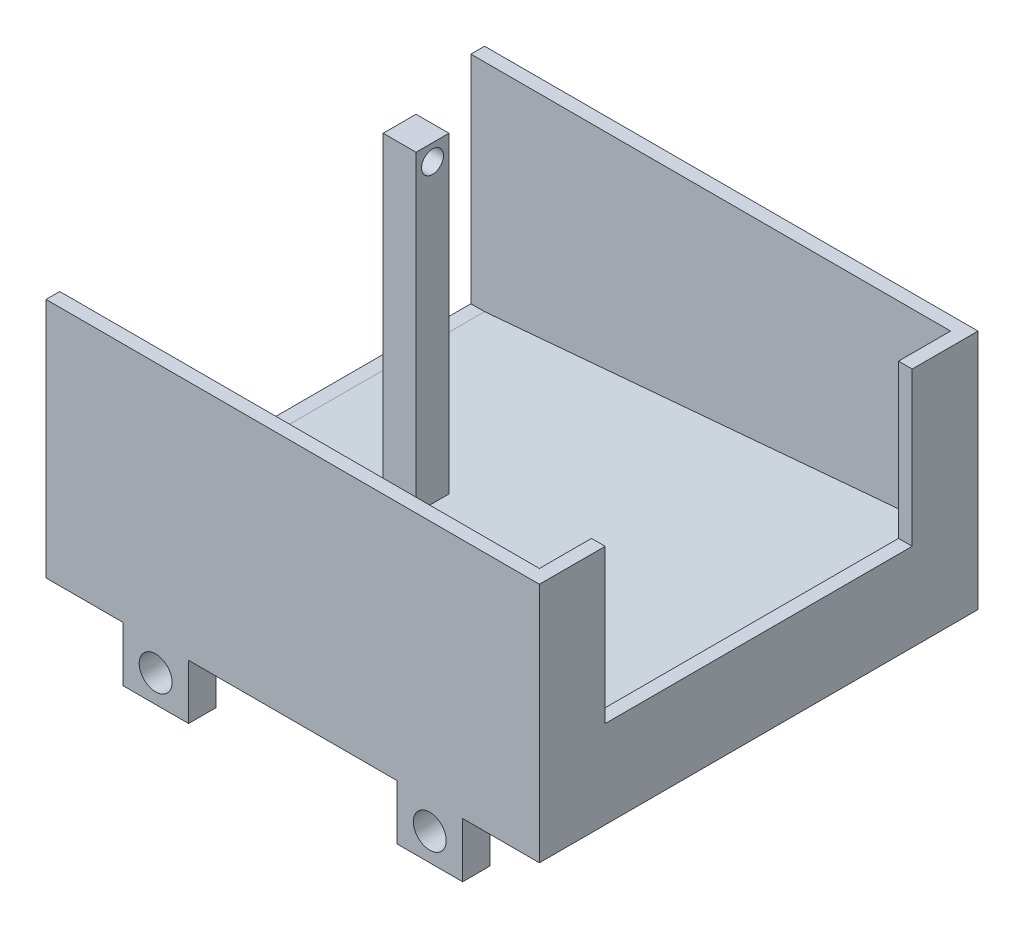
from build123d import *

# Parameters (mm, degrees)
SKETCH1_W            = 450
SKETCH1_H            = 400
BOSS_EXTRUDE1_DEPTH  = 220
SKETCH2_W            = 425
SKETCH2_H            = 375
CUT_EXTRUDE1_DEPTH   = 160
SKETCH3_W            = 280
SKETCH3_H            = 140
CUT_EXTRUDE2_DEPTH   = 12.5
SKETCH4_W            = 30
SKETCH4_H            = 30
BOSS_EXTRUDE2_DEPTH  = 260
SKETCH5_R            = 10
CUT_EXTRUDE3_DEPTH   = 30
SKETCH6_W            = 60
SKETCH6_H            = 25
BOSS_EXTRUDE3_DEPTH  = 50
SKETCH7_R            = 15
CUT_EXTRUDE4_DEPTH   = 25
CUT_EXTRUDE5_START   = -25
SKETCH8_R            = 15
CUT_EXTRUDE5_DEPTH   = 25
CUT_EXTRUDE6_START   = -187.5
CUT_EXTRUDE6_DEPTH   = 375
CUT_EXTRUDE6_2_DEPTH = 172.5
CUT_EXTRUDE6_START_2 = 15
CUT_EXTRUDE6_3_DEPTH = 172.5
SKETCH10_W           = 375
SKETCH10_H           = 197.182681999
CUT_EXTRUDE7_DEPTH   = 12.5


# Read off the part's stored shape, not the designer's step: Cut-Extrude6
with BuildPart() as part:
    # Sketch1 → Boss-Extrude1 (new body)
    with BuildSketch(Plane(origin=(0, 0, 0), x_dir=(1, 0, 0), z_dir=(0, 1, 0))):
        Rectangle(SKETCH1_W, SKETCH1_H)
    extrude(amount=BOSS_EXTRUDE1_DEPTH)

    # Sketch2 → Cut-Extrude1 (cut)
    with BuildSketch(Plane(origin=(0, 220, 0), x_dir=(1, 0, 0), z_dir=(0, 1, 0))):
        Rectangle(SKETCH2_W, SKETCH2_H)
    extrude(amount=-CUT_EXTRUDE1_DEPTH, mode=Mode.SUBTRACT)

    # Sketch3 → Cut-Extrude2 (cut)
    with BuildSketch(Plane(origin=(225, 0, 0), x_dir=(0, 0, -1), z_dir=(1, 0, 0))):
        with Locations((0, 150)):
            Rectangle(SKETCH3_W, SKETCH3_H)
    extrude(amount=-CUT_EXTRUDE2_DEPTH, mode=Mode.SUBTRACT)

    # Sketch4 → Boss-Extrude2 (add)
    with BuildSketch(Plane(origin=(0, 60, 0), x_dir=(1, 0, 0), z_dir=(0, 1, 0))):
        with Locations((-87.5, 0)):
            Rectangle(SKETCH4_W, SKETCH4_H)
    extrude(amount=BOSS_EXTRUDE2_DEPTH)

    # Sketch5 → Cut-Extrude3 (cut)
    with BuildSketch(Plane(origin=(-72.5, 0, 0), x_dir=(0, 0, -1), z_dir=(1, 0, 0))):
        with Locations((0, 305)):
            Circle(SKETCH5_R)
    extrude(amount=-CUT_EXTRUDE3_DEPTH, mode=Mode.SUBTRACT)

    # Sketch6 → Boss-Extrude3 (add)
    with BuildSketch(Plane.XZ):
        with Locations((125, 187.5)):
            Rectangle(SKETCH6_W, SKETCH6_H)
        with Locations((-125, 187.5)):
            Rectangle(SKETCH6_W, SKETCH6_H)
        with Locations((-125, -187.5)):
            Rectangle(SKETCH6_W, SKETCH6_H)
        with Locations((125, -187.5)):
            Rectangle(SKETCH6_W, SKETCH6_H)
    extrude(amount=BOSS_EXTRUDE3_DEPTH)

    # Sketch7 → Cut-Extrude4 (cut)
    with BuildSketch(Plane(origin=(0, 0, -200), x_dir=(-1, 0, 0), z_dir=(0, 0, -1))):
        with Locations((125, -25)):
            Circle(SKETCH7_R)
        with Locations((-125, -25)):
            Circle(SKETCH7_R)
    extrude(amount=-CUT_EXTRUDE4_DEPTH, mode=Mode.SUBTRACT)

    # Sketch8 → Cut-Extrude5 (cut)
    with BuildSketch(Plane.XY.offset(200).offset(CUT_EXTRUDE5_START)):
        with Locations(Location((-125, -25, 0), (0, 0, 180))):
            Circle(SKETCH8_R)
        with Locations(Location((125, -25, 0), (0, 0, 180))):
            Circle(SKETCH8_R)
    extrude(amount=CUT_EXTRUDE5_DEPTH, mode=Mode.SUBTRACT)

    # Cut-Extrude6 outline → Cut-Extrude6 (cut)
    with BuildSketch(Plane.XY.offset(CUT_EXTRUDE6_START)):
        Polygon((-102.5, 60), (-212.5, 60), (-212.5, 22.817318001), (-102.5, 32.441070989), align=None)
        Polygon((212.5, 60), (-72.5, 60), (-72.5, 35.065730895), align=None)
    extrude(amount=CUT_EXTRUDE6_DEPTH, mode=Mode.SUBTRACT)

    # Cut-Extrude6 2 outline → Cut-Extrude6 2 (cut)
    with BuildSketch(Plane.XY.offset(CUT_EXTRUDE6_START)):
        Polygon((-72.5, 60), (-102.5, 60), (-102.5, 32.441070989), (-72.5, 35.065730895), align=None)
    extrude(amount=CUT_EXTRUDE6_2_DEPTH, mode=Mode.SUBTRACT)

    # Cut-Extrude6 3 outline → Cut-Extrude6 3 (cut)
    with BuildSketch(Plane.XY.offset(CUT_EXTRUDE6_START_2)):
        Polygon((-72.5, 60), (-102.5, 60), (-102.5, 32.441070989), (-72.5, 35.065730895), align=None)
    extrude(amount=CUT_EXTRUDE6_3_DEPTH, mode=Mode.SUBTRACT)

    # Sketch10 → Cut-Extrude7 (cut)
    with BuildSketch(Plane(origin=(-212.5, 0, 0), x_dir=(0, 0, -1), z_dir=(1, 0, 0))):
        with Locations((0, 121.408659)):
            Rectangle(SKETCH10_W, SKETCH10_H)
    extrude(amount=-CUT_EXTRUDE7_DEPTH, mode=Mode.SUBTRACT)


solid = part.part
